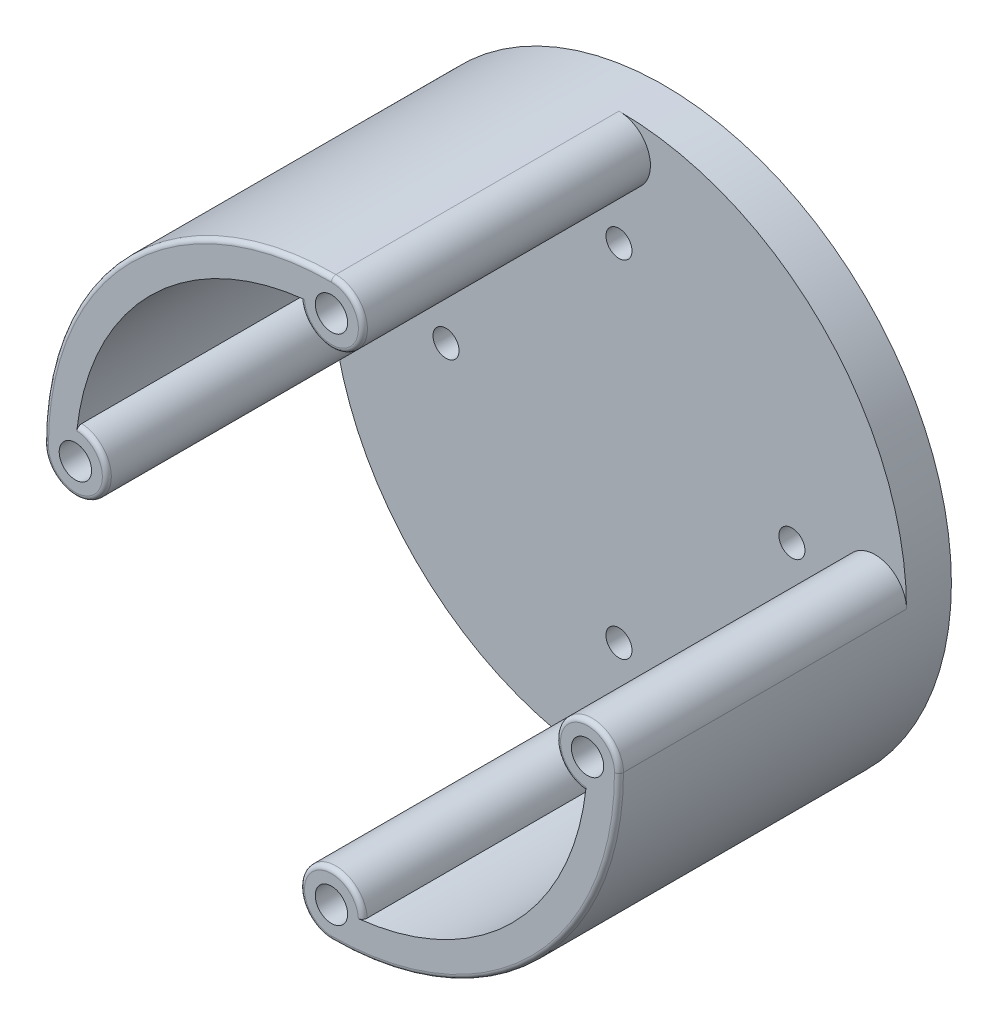
from build123d import *

# Parameters (mm, degrees)
SKETCH_1_R                     = 32
SKETCH_1_R_2                   = 1.45
EXTRUDE_1_DEPTH                = 5
SKETCH_2_R                     = 1.8
CUT_EXTRUDE_1_DEPTH            = 3
EXTRUDE_START                  = 32
SKETCH_3_R                     = 3.5
SKETCH_3_R_2                   = 1.8
EXTRUDE_2_DEPTH                = 32
EXTRUDE_3_DEPTH                = 32
SKETCH_5_R                     = 3
CUT_EXTRUDE_2_DEPTH            = 8
HOLE_WIZARD_M2_5_1_D           = 2.9
HOLE_WIZARD_M2_5_1_CSINK_D     = 5.4
HOLE_WIZARD_M2_5_1_CSINK_ANGLE = 90
FILLET_1_R                     = 0.5


with BuildPart() as part:
    # 草图1 → 凸台-拉伸1 (new body)
    with BuildSketch(Plane.XY):
        Circle(SKETCH_1_R)
        with Locations((0, 19.25)):
            Circle(SKETCH_1_R_2, mode=Mode.SUBTRACT)
        with Locations((19.25, 0)):
            Circle(SKETCH_1_R_2, mode=Mode.SUBTRACT)
        with Locations((0, -19.25)):
            Circle(SKETCH_1_R_2, mode=Mode.SUBTRACT)
        with Locations((-19.25, 0)):
            Circle(SKETCH_1_R_2, mode=Mode.SUBTRACT)
    extrude(amount=EXTRUDE_1_DEPTH)

    # 草图2 → 切除-拉伸1 (cut)
    with BuildSketch(Plane.XY.offset(5)):
        with Locations((0, 28.5)):
            Circle(SKETCH_2_R)
        with Locations((28.5, 0)):
            Circle(SKETCH_2_R)
        with Locations((0, -28.5)):
            Circle(SKETCH_2_R)
        with Locations((-28.5, 0)):
            Circle(SKETCH_2_R)
    extrude(amount=-CUT_EXTRUDE_1_DEPTH, mode=Mode.SUBTRACT)

    # 草图3 → 凸台-拉伸2 (add)
    # profile 1 of 4: a face of its own
    with BuildSketch(Plane.XY.offset(5).offset(EXTRUDE_START)):
        with Locations((-28.5, 0)):
            Circle(SKETCH_3_R)
        with Locations((-28.5, 0)):
            Circle(SKETCH_3_R_2, mode=Mode.SUBTRACT)
    # profile 2 of 4: a face of its own
    with BuildSketch(Plane.XY.offset(5).offset(EXTRUDE_START)):
        with Locations((0, 28.5)):
            Circle(SKETCH_3_R)
        with Locations((0, 28.5)):
            Circle(SKETCH_3_R_2, mode=Mode.SUBTRACT)
    # profile 3 of 4: a face of its own
    with BuildSketch(Plane.XY.offset(5).offset(EXTRUDE_START)):
        with Locations((28.5, 0)):
            Circle(SKETCH_3_R)
        with Locations((28.5, 0)):
            Circle(SKETCH_3_R_2, mode=Mode.SUBTRACT)
    # profile 4 of 4: a face of its own
    with BuildSketch(Plane.XY.offset(5).offset(EXTRUDE_START)):
        with Locations((0, -28.5)):
            Circle(SKETCH_3_R)
        with Locations((0, -28.5)):
            Circle(SKETCH_3_R_2, mode=Mode.SUBTRACT)
    extrude(amount=-EXTRUDE_2_DEPTH)

    # 草图4 → 凸台-拉伸3 (add)
    with BuildSketch(Plane.XY.offset(5).offset(EXTRUDE_START)):
        with BuildLine():
            ThreePointArc((0, -32), (22.627416998, -22.627416998), (32, 0))
            ThreePointArc((32, 0), (30.897687117, -2.549724787), (28.285087719, -3.493395585))
            ThreePointArc((28.285087719, -3.493395585), (20.152543264, -20.152543264), (3.493395585, -28.285087719))
            ThreePointArc((3.493395585, -28.285087719), (2.549724787, -30.897687117), (0, -32))
        make_face()
        with BuildLine():
            ThreePointArc((-3.493395585, 28.285087719), (-2.549724787, 30.897687117), (0, 32))
            ThreePointArc((0, 32), (-22.627416998, 22.627416998), (-32, 0))
            ThreePointArc((-32, 0), (-30.897687117, 2.549724787), (-28.285087719, 3.493395585))
            ThreePointArc((-28.285087719, 3.493395585), (-20.152543264, 20.152543264), (-3.493395585, 28.285087719))
        make_face()
    extrude(amount=-EXTRUDE_3_DEPTH)

    # 草图5 → 切除-拉伸2 (cut)
    with BuildSketch(Plane(origin=(0, 0, 0), x_dir=(-1, 0, 0), z_dir=(0, 0, -1))):
        with Locations((28.5, 0)):
            Circle(SKETCH_5_R)
        with Locations((0, -28.5)):
            Circle(SKETCH_5_R)
        with Locations((-28.5, 0)):
            Circle(SKETCH_5_R)
        with Locations((0, 28.5)):
            Circle(SKETCH_5_R)
    extrude(amount=-CUT_EXTRUDE_2_DEPTH, mode=Mode.SUBTRACT)

    # M2.5 十字槽半沉头木螺钉的锥形沉头孔1 (through all)
    with Locations(Plane(origin=(0, 0, 0), x_dir=(-1, 0, 0), z_dir=(0, 0, -1))):
        with Locations((-19.25, 0), (0, -19.25), (19.25, 0), (0, 19.25)):
            CounterSinkHole(HOLE_WIZARD_M2_5_1_D / 2, HOLE_WIZARD_M2_5_1_CSINK_D / 2, counter_sink_angle=HOLE_WIZARD_M2_5_1_CSINK_ANGLE)

    # 圆角1
    fillet_1_edges = [part.edges().sort_by_distance(p)[0] for p in [
        (2.549724787, 26.102312883, 37),
        (-26.102312883, -2.549724787, 37),
        (-2.549724787, -26.102312883, 37),
        (22.627416998, -22.627416998, 37),
        (-22.627416998, 22.627416998, 37),
        (26.102312883, 2.549724787, 37),
    ]]
    fillet(fillet_1_edges, radius=FILLET_1_R)


solid = part.part
